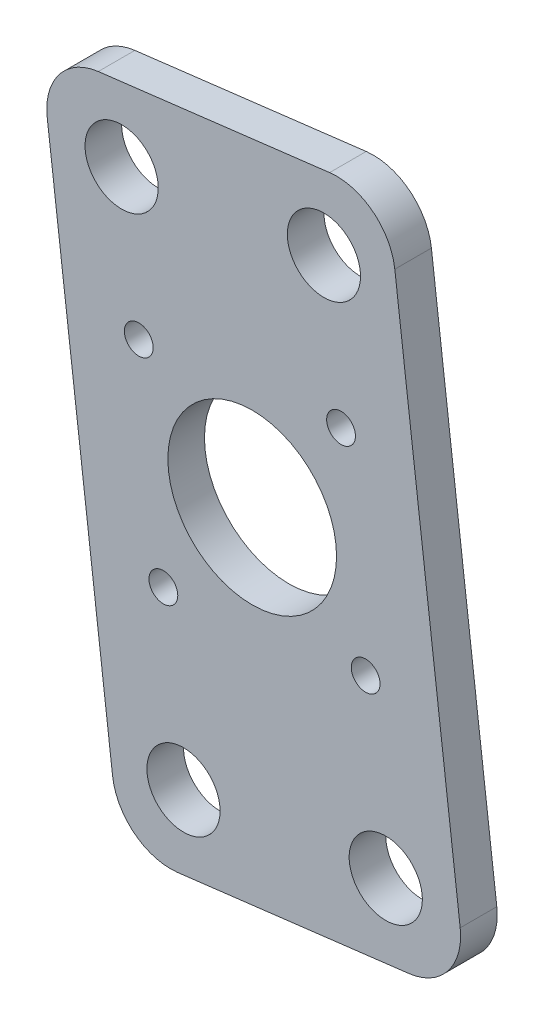
from build123d import *

# Parameters (mm, degrees)
SKETCH1_R           = 3.175
SKETCH1_R_2         = 7.317167392
BOSS_EXTRUDE2_DEPTH = 3.175


with BuildPart() as part:
    # Sketch1 → Boss-Extrude2 (new body)
    with BuildSketch(Plane.XY):
        with BuildLine():
            ThreePointArc((-103.75515137, -130.108023512), (-107.141377815, -132.018654189), (-108.18478159, -135.764097779))
            Line((-108.18478159, -135.764097779), (-102.512477877, -182.410481032))
            ThreePointArc((-102.512477877, -182.410481032), (-100.6018472, -185.796707477), (-96.85640361, -186.840111252))
            Line((-96.85640361, -186.840111252), (-76.78657681, -184.399575778))
            ThreePointArc((-76.78657681, -184.399575778), (-73.400350364, -182.488945101), (-72.356946589, -178.743501511))
            Line((-72.356946589, -178.743501511), (-78.029250302, -132.097118258))
            ThreePointArc((-78.029250302, -132.097118258), (-79.939880979, -128.710891812), (-83.685324569, -127.667488038))
            Line((-83.685324569, -127.667488038), (-103.75515137, -130.108023512))
        make_face()
        with Locations((-96.362218078, -180.383240442)):
            Circle(SKETCH1_R, mode=Mode.SUBTRACT)
        with BuildLine():
            ThreePointArc((-99.091795046, -165.258660878), (-97.336954979, -165.045268432), (-97.123562532, -166.8001085))
            ThreePointArc((-97.123562532, -166.8001085), (-98.8784026, -167.013500946), (-99.091795046, -165.258660878))
        make_face(mode=Mode.SUBTRACT)
        with Locations((-78.813817399, -178.249315979)):
            Circle(SKETCH1_R, mode=Mode.SUBTRACT)
        with BuildLine():
            ThreePointArc((-79.575161853, -164.666184037), (-81.330001921, -164.879576483), (-81.543394368, -163.124736415))
            ThreePointArc((-81.543394368, -163.124736415), (-79.7885543, -162.911343969), (-79.575161853, -164.666184037))
        make_face(mode=Mode.SUBTRACT)
        with BuildLine():
            ThreePointArc((-99.257486995, -149.251707821), (-101.012327063, -149.465100267), (-101.225719509, -147.710260199))
            ThreePointArc((-101.225719509, -147.710260199), (-99.470879442, -147.496867753), (-99.257486995, -149.251707821))
        make_face(mode=Mode.SUBTRACT)
        with Locations((-90.400440681, -156.188222118)):
            Circle(SKETCH1_R_2, mode=Mode.SUBTRACT)
        with Locations((-101.72791078, -136.258283311)):
            Circle(SKETCH1_R, mode=Mode.SUBTRACT)
        with BuildLine():
            ThreePointArc((-83.677318831, -145.576335736), (-81.922478763, -145.36294329), (-81.709086316, -147.117783358))
            ThreePointArc((-81.709086316, -147.117783358), (-83.463926384, -147.331175804), (-83.677318831, -145.576335736))
        make_face(mode=Mode.SUBTRACT)
        with Locations((-84.179510101, -134.124358848)):
            Circle(SKETCH1_R, mode=Mode.SUBTRACT)
    extrude(amount=BOSS_EXTRUDE2_DEPTH)


solid = part.part
